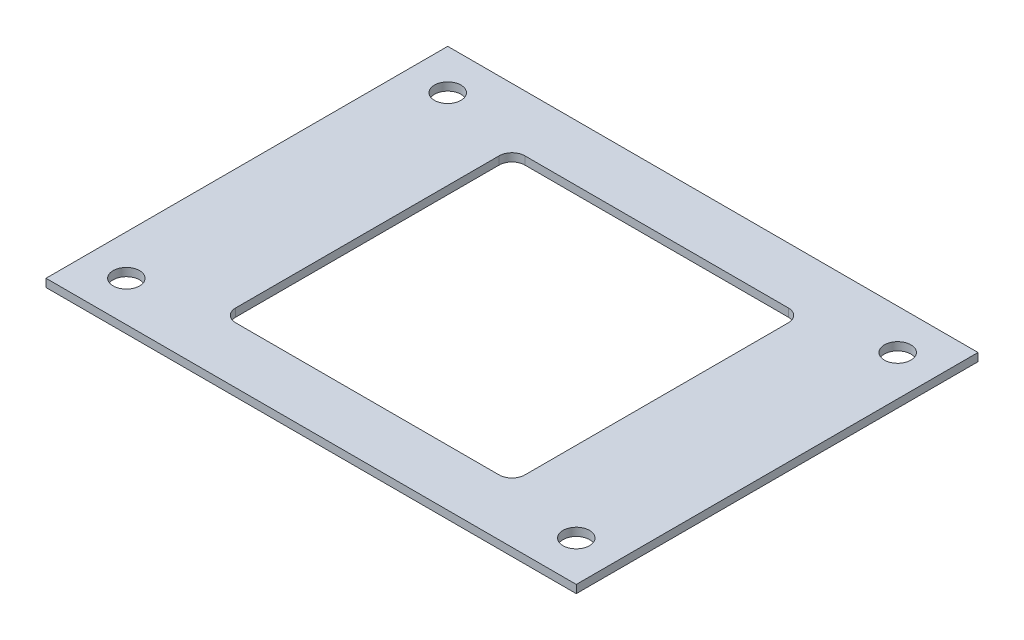
from build123d import *

# Parameters (mm, degrees)
SKETCH1_W           = 66
SKETCH1_H           = 50
SKETCH1_R           = 1.65
SKETCH1_W_2         = 36
SKETCH1_H_2         = 36
BOSS_EXTRUDE1_DEPTH = 1
FILLET1_R           = 1.6


with BuildPart() as part:
    # Sketch1 → Boss-Extrude1 (new body)
    with BuildSketch(Plane(origin=(0, 0, 0), x_dir=(1, 0, 0), z_dir=(0, 1, 0))):
        Rectangle(SKETCH1_W, SKETCH1_H)
        with Locations((-28, 20)):
            Circle(SKETCH1_R, mode=Mode.SUBTRACT)
        with Locations((-28, -20)):
            Circle(SKETCH1_R, mode=Mode.SUBTRACT)
        with Locations((28, 20)):
            Circle(SKETCH1_R, mode=Mode.SUBTRACT)
        with Locations((28, -20)):
            Circle(SKETCH1_R, mode=Mode.SUBTRACT)
        Rectangle(SKETCH1_W_2, SKETCH1_H_2, mode=Mode.SUBTRACT)
    extrude(amount=BOSS_EXTRUDE1_DEPTH)

    # Fillet1
    fillet1_edges = [part.edges().sort_by_distance(p)[0] for p in [
        (-18, 0.5, 18),
        (18, 0.5, 18),
        (18, 0.5, -18),
        (-18, 0.5, -18),
    ]]
    fillet(fillet1_edges, radius=FILLET1_R)


solid = part.part
